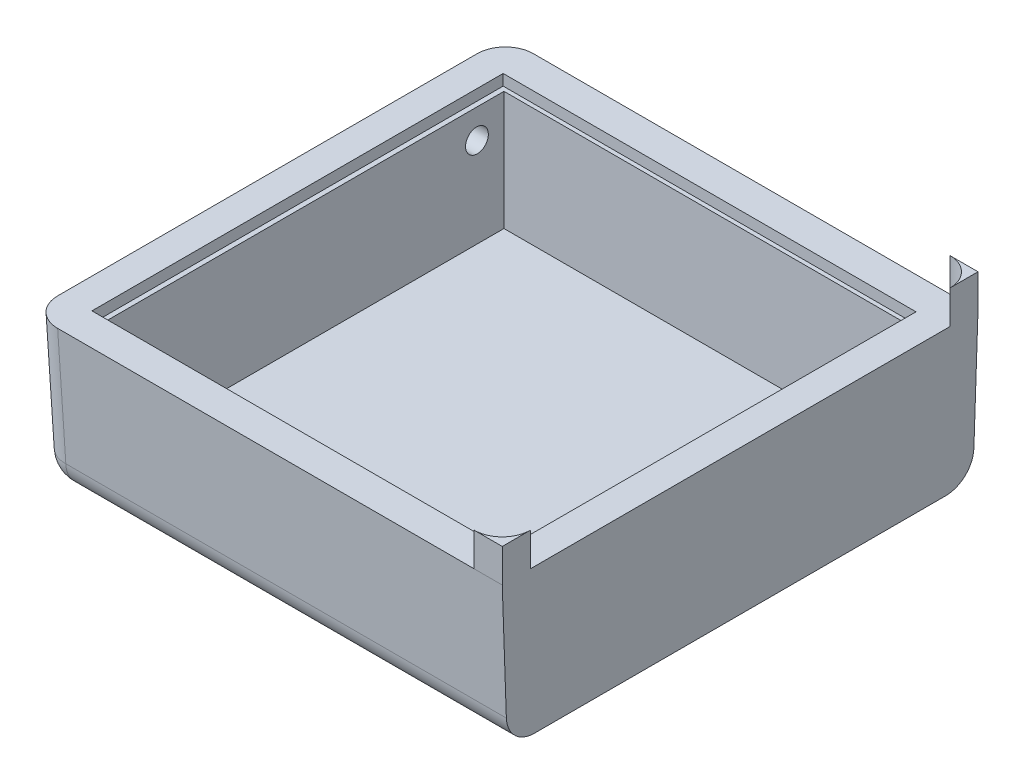
from build123d import *

# Parameters (mm, degrees)
SKETCH1_W               = 295
SKETCH1_H               = 292.1
BOSS_EXTRUDE1_DEPTH     = 88.69
BOSS_EXTRUDE1_DRAFT     = -2
SKETCH3_W               = 253.5
SKETCH3_H               = 252.5
CUT_EXTRUDE3_DEPTH      = 6.5
CUT_EXTRUDE3_DRAFT      = -2
SKETCH5_W               = 247
SKETCH5_H               = 247
CUT_EXTRUDE4_DEPTH      = 70.5
CUT_EXTRUDE4_DRAFT      = -2
CUT_EXTRUDE5_DEPTH      = 228.203831614
CUT_EXTRUDE5_DEPTH_BACK = 228.203831614
FILLET2_R               = 17.27
BOSS_EXTRUDE2_DEPTH     = 20.53
CUT_EXTRUDE6_REACH      = 337.359
SKETCH8_R               = 7


with BuildPart() as part:
    # Sketch1 → Boss-Extrude1 (with draft: the straight prism first)
    with BuildSketch(Plane(origin=(0, 0, 0), x_dir=(1, 0, 0), z_dir=(0, 1, 0))):
        with Locations((2.25, 0)):
            Rectangle(SKETCH1_W, SKETCH1_H)
    extrude(amount=-BOSS_EXTRUDE1_DEPTH)
    # Boss-Extrude1: the draft: its side faces are tilted about the plane it starts from
    boss_extrude1_sides = [part.faces().sort_by_distance(p)[0] for p in [
        (2.25, -44.345, 146.05),
        (149.75, -44.345, 0),
        (2.25, -44.345, -146.05),
        (-145.25, -44.345, 0),
    ]]
    draft(boss_extrude1_sides, Plane(origin=(0, 0, 0), x_dir=(1, 0, 0), z_dir=(0, 1, 0)), BOSS_EXTRUDE1_DRAFT)


with BuildPart() as cut_extrude3_tool:
    # Sketch3 → Cut-Extrude3 (with draft: the straight prism first)
    with BuildSketch(Plane(origin=(0, 0, 0), x_dir=(1, 0, 0), z_dir=(0, 1, 0))):
        Rectangle(SKETCH3_W, SKETCH3_H)
    extrude(amount=-CUT_EXTRUDE3_DEPTH)
    # Cut-Extrude3: the draft: its side faces are tilted about the plane it starts from
    cut_extrude3_sides = [cut_extrude3_tool.faces().sort_by_distance(p)[0] for p in [
        (0, -3.25, 126.25),
        (126.75, -3.25, 0),
        (0, -3.25, -126.25),
        (-126.75, -3.25, 0),
    ]]
    draft(cut_extrude3_sides, Plane(origin=(0, 0, 0), x_dir=(1, 0, 0), z_dir=(0, 1, 0)), CUT_EXTRUDE3_DRAFT)


with BuildPart() as part_1:
    add(part.part)

    # Cut-Extrude3: cut by cut_extrude3_tool
    add(cut_extrude3_tool.part, mode=Mode.SUBTRACT)


with BuildPart() as cut_extrude4_tool:
    # Sketch5 → Cut-Extrude4 (with draft: the straight prism first)
    with BuildSketch(Plane(origin=(0, -6.5, 0), x_dir=(1, 0, 0), z_dir=(0, 1, 0))):
        Rectangle(SKETCH5_W, SKETCH5_H)
    extrude(amount=-CUT_EXTRUDE4_DEPTH)
    # Cut-Extrude4: the draft: its side faces are tilted about the plane it starts from
    cut_extrude4_sides = [cut_extrude4_tool.faces().sort_by_distance(p)[0] for p in [
        (0, -41.75, 123.5),
        (123.5, -41.75, 0),
        (0, -41.75, -123.5),
        (-123.5, -41.75, 0),
    ]]
    draft(cut_extrude4_sides, Plane(origin=(0, -6.5, 0), x_dir=(1, 0, 0), z_dir=(0, 1, 0)), CUT_EXTRUDE4_DRAFT)


with BuildPart() as part_2:
    add(part_1.part)

    # Cut-Extrude4: cut by cut_extrude4_tool
    add(cut_extrude4_tool.part, mode=Mode.SUBTRACT)

    # Sketch6 → Cut-Extrude5 (cut, two sides: drawn at the far end of the back side and taken through both)
    with BuildSketch(Plane.XY.offset(-CUT_EXTRUDE5_DEPTH_BACK)):
        Polygon((149.75, 0), (145, 0), (145, -88.69), (146.652876954, -88.69), align=None)
    extrude(amount=CUT_EXTRUDE5_DEPTH + CUT_EXTRUDE5_DEPTH_BACK, mode=Mode.SUBTRACT)

    # Fillet2
    fillet2_edges = [part_2.edges().sort_by_distance(p)[0] for p in [
        (1.423561523, -88.69, -142.952876954),
        (-143.701438477, -44.345, -144.501438477),
        (-142.152876954, -88.69, 0),
        (-143.701438477, -44.345, 144.501438477),
        (1.423561523, -88.69, 142.952876954),
    ]]
    fillet(fillet2_edges, radius=FILLET2_R)

    # Sketch7 → Boss-Extrude2 (add)
    with BuildSketch(Plane(origin=(0, 0, 0), x_dir=(1, 0, 0), z_dir=(0, 1, 0))):
        with BuildLine():
            Line((145, 128.78), (145, 146.05))
            Line((145, 146.05), (127.73, 146.05))
            ThreePointArc((127.73, 146.05), (139.941734111, 140.991734111), (145, 128.78))
        make_face()
        with BuildLine():
            Line((145, -146.05), (127.73, -146.05))
            ThreePointArc((127.73, -146.05), (139.941734111, -140.991734111), (145, -128.78))
            Line((145, -128.78), (145, -146.05))
        make_face()
    extrude(amount=BOSS_EXTRUDE2_DEPTH)

    # Sketch8 → Cut-Extrude6 (cut, up to next)
    with BuildSketch(Plane(origin=(-145.07308915, -5.066063906, 0), x_dir=(0, 0, 1), z_dir=(-0.9993908270190958, -0.03489949670250105, 0)), mode=Mode.PRIVATE) as cut_extrude6_sk1:
        with Locations((-106.3, -19.400848104)):
            Circle(SKETCH8_R)
    cut_extrude6_tool1 = extrude(cut_extrude6_sk1.sketch, amount=-CUT_EXTRUDE6_REACH, mode=Mode.PRIVATE) & part_2.part
    add(cut_extrude6_tool1.solids().sort_by_distance((-144.396009, -24.455094, -106.3))[0], mode=Mode.SUBTRACT)


solid = part_2.part
